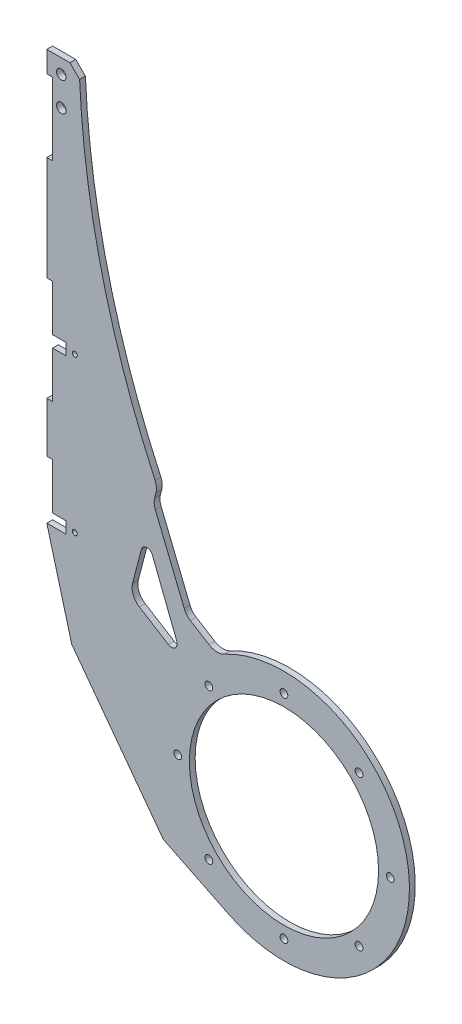
from build123d import *

# Parameters (mm, degrees)
SKETCH1_R           = 1.3
SKETCH1_R_2         = 2.5
SKETCH1_R_3         = 49
SKETCH1_R_4         = 2
BOSS_EXTRUDE1_DEPTH = 3


with BuildPart() as part:
    # Sketch1 → Boss-Extrude1 (new body)
    with BuildSketch(Plane.XY):
        with BuildLine():
            Line((-38.062884368, 0.451460889), (-37.367761878, 3.130298494))
            ThreePointArc((-37.367761878, 3.130298494), (-37.143659339, 5.858363356), (-37.85233951, 8.502287004))
            ThreePointArc((-37.85233951, 8.502287004), (-65.162202725, 86.730278313), (-76.918584287, 168.75))
            Line((-76.918584287, 168.75), (-81.918584287, 173.75))
            Line((-81.918584287, 173.75), (-93.918584287, 173.75))
            Line((-93.918584287, 173.75), (-93.918584287, 162.75))
            Line((-93.918584287, 162.75), (-90.918584287, 162.75))
            Line((-90.918584287, 162.75), (-90.918584287, 125.25))
            Line((-90.918584287, 125.25), (-93.918584287, 125.25))
            Line((-93.918584287, 125.25), (-93.918584287, 71.25))
            Line((-93.918584287, 71.25), (-90.918584287, 71.25))
            Line((-90.918584287, 71.25), (-90.918584287, 47.25))
            Line((-90.918584287, 47.25), (-83.918584287, 47.25))
            Line((-83.918584287, 47.25), (-83.918584287, 41.25))
            Line((-83.918584287, 41.25), (-90.918584287, 41.25))
            Line((-90.918584287, 41.25), (-90.918584287, 17.25))
            Line((-90.918584287, 17.25), (-93.918584287, 17.25))
            Line((-93.918584287, 17.25), (-93.918584287, -8.75))
            Line((-93.918584287, -8.75), (-90.918584287, -8.75))
            Line((-90.918584287, -8.75), (-90.918584287, -32.75))
            Line((-90.918584287, -32.75), (-83.918584287, -32.75))
            Line((-83.918584287, -32.75), (-83.918584287, -38.75))
            Line((-83.918584287, -38.75), (-93.918584287, -38.75))
            Line((-93.918584287, -38.75), (-80.986639626, -86.687961526))
            Line((-80.986639626, -86.687961526), (-33.600758689, -150.449899901))
            Line((-33.600758689, -150.449899901), (0.892231282, -167.397451242))
            ThreePointArc((0.892231282, -167.397451242), (93.899855637, -107.18975202), (-1.890185996, -51.515223215))
            ThreePointArc((-1.890185996, -51.515223215), (-5.934824333, -52.466948084), (-9.911269177, -51.261640698))
            Line((-9.911269177, -51.261640698), (-19.538503354, -45.265816263))
            ThreePointArc((-19.538503354, -45.265816263), (-21.428125374, -43.628718712), (-22.720130169, -41.488278716))
            Line((-22.720130169, -41.488278716), (-37.730198384, -4.571046116))
            ThreePointArc((-37.730198384, -4.571046116), (-38.301844147, -2.086639475), (-38.062884368, 0.451460889))
        make_face()
        with Locations((-79.418584287, -35.75)):
            Circle(SKETCH1_R, mode=Mode.SUBTRACT)
        with Locations((-86.418584287, 166.25)):
            Circle(SKETCH1_R_2, mode=Mode.SUBTRACT)
        with Locations((-86.418584287, 151.25)):
            Circle(SKETCH1_R_2, mode=Mode.SUBTRACT)
        with Locations((28.918584287, -108.75)):
            Circle(SKETCH1_R_3, mode=Mode.SUBTRACT)
        with Locations((-9.972288678, -147.640872965)):
            Circle(SKETCH1_R_4, mode=Mode.SUBTRACT)
        with Locations((-26.081415713, -108.75)):
            Circle(SKETCH1_R_4, mode=Mode.SUBTRACT)
        with Locations((-9.972288678, -69.859127035)):
            Circle(SKETCH1_R_4, mode=Mode.SUBTRACT)
        with Locations((28.918584287, -53.75)):
            Circle(SKETCH1_R_4, mode=Mode.SUBTRACT)
        with Locations((67.809457252, -69.859127035)):
            Circle(SKETCH1_R_4, mode=Mode.SUBTRACT)
        with Locations((83.918584287, -108.75)):
            Circle(SKETCH1_R_4, mode=Mode.SUBTRACT)
        with Locations((67.809457252, -147.640872965)):
            Circle(SKETCH1_R_4, mode=Mode.SUBTRACT)
        with Locations((28.918584287, -163.75)):
            Circle(SKETCH1_R_4, mode=Mode.SUBTRACT)
        with Locations((-79.418584287, 44.25)):
            Circle(SKETCH1_R, mode=Mode.SUBTRACT)
        with BuildLine():
            Line((-44.935497705, -26.033964786), (-49.484738164, -43.565661124))
            ThreePointArc((-49.484738164, -43.565661124), (-49.17066406, -48.541980775), (-45.970425365, -52.365705676))
            Line((-45.970425365, -52.365705676), (-30.95696797, -61.716060414))
            ThreePointArc((-30.95696797, -61.716060414), (-27.4539, -61.477081731), (-26.576966843, -58.077142872))
            Line((-26.576966843, -58.077142872), (-39.237629278, -25.69506395))
            ThreePointArc((-39.237629278, -25.69506395), (-42.209788255, -23.792762359), (-44.935497705, -26.033964786))
        make_face(mode=Mode.SUBTRACT)
    extrude(amount=BOSS_EXTRUDE1_DEPTH)


solid = part.part
